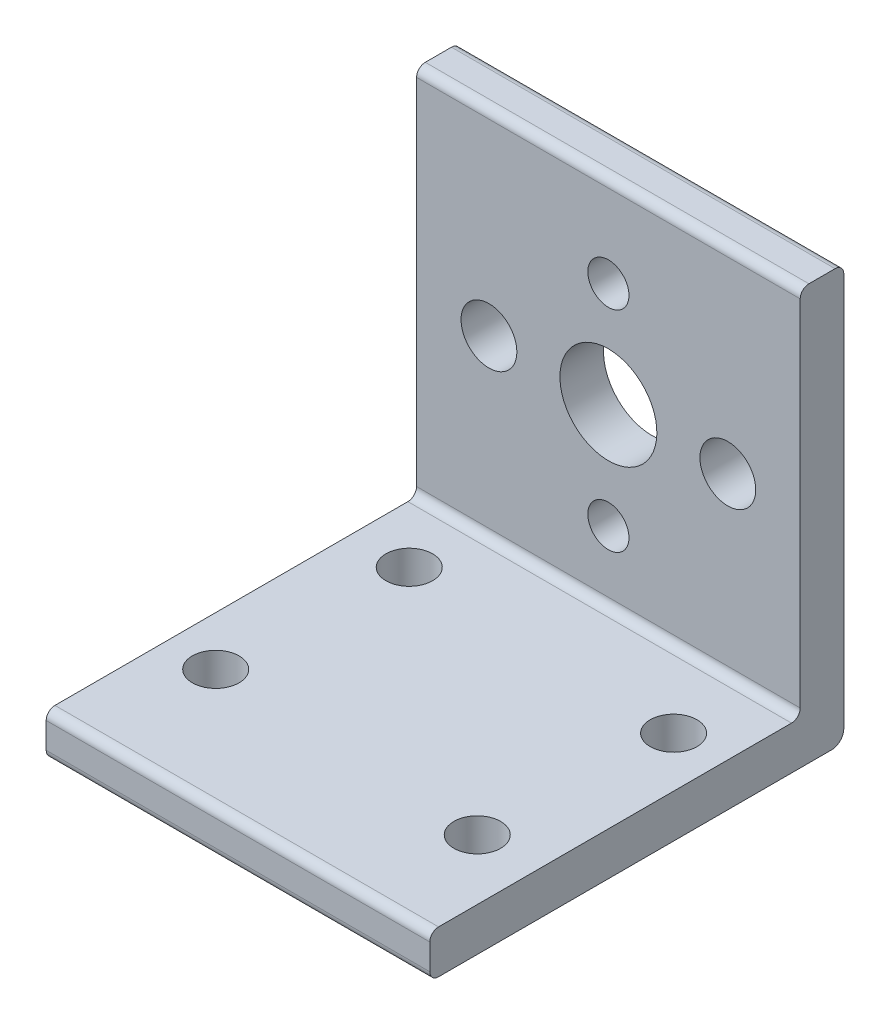
from build123d import *

# Parameters (mm, degrees)
BOSS_EXTRUDE1_DEPTH     = 27.94
SKETCH2_R               = 3.5306
SKETCH2_R_2             = 1.4986
SKETCH2_R_3             = 2.032
MOTOR_MOUNT_HOLES_DEPTH = 52.022202187
SKETCH3_R               = 1.7018
PLATE_MOUNT_HOLES_DEPTH = 52.022202187
FILLET1_R               = 0.635
FILLET2_R               = 0.889
FILLET3_R               = 0.635


with BuildPart() as part:
    # Sketch1 → Boss-Extrude1 (new body)
    with BuildSketch(Plane(origin=(0, 0, 0), x_dir=(0, 0, -1), z_dir=(1, 0, 0))):
        Polygon((0, 0), (0, -30.226), (-30.1498, -30.226), (-30.1498, -27.0764), (-3.175, -27.0764), (-3.175, 0), align=None)
    extrude(amount=BOSS_EXTRUDE1_DEPTH)

    # Sketch2 → Motor_Mount_holes (cut, through all)
    with BuildSketch(Plane.XY):
        with Locations((13.97, -14.3002)):
            Circle(SKETCH2_R)
        with Locations((13.97, -6.6548)):
            Circle(SKETCH2_R_2)
        with Locations((5.2705, -14.3002)):
            Circle(SKETCH2_R_3)
        with Locations((22.6695, -14.3002)):
            Circle(SKETCH2_R_3)
        with Locations((13.97, -21.9456)):
            Circle(SKETCH2_R_2)
    extrude(amount=MOTOR_MOUNT_HOLES_DEPTH, mode=Mode.SUBTRACT)

    # Sketch3 → Plate_Mount_Holes (cut, through all)
    with BuildSketch(Plane(origin=(0, -30.226, 0), x_dir=(1, 0, 0), z_dir=(0, 1, 0))):
        with Locations((4.191, -7.8994)):
            Circle(SKETCH3_R)
        with Locations((24.2824, -8.7376)):
            Circle(SKETCH3_R)
        with Locations((3.5814, -21.3868)):
            Circle(SKETCH3_R)
        with Locations((23.5458, -22.3012)):
            Circle(SKETCH3_R)
    extrude(amount=PLATE_MOUNT_HOLES_DEPTH, mode=Mode.SUBTRACT)

    # Fillet1
    fillet1_edges = [part.edges().sort_by_distance(p)[0] for p in [
        (13.97, -27.0764, 3.175),
    ]]
    fillet(fillet1_edges, radius=FILLET1_R)

    # Fillet2
    fillet2_edges = [part.edges().sort_by_distance(p)[0] for p in [
        (13.97, -30.226, 0),
    ]]
    fillet(fillet2_edges, radius=FILLET2_R)

    # Fillet3
    fillet3_edges = [part.edges().sort_by_distance(p)[0] for p in [
        (13.97, -30.226, 30.1498),
        (13.97, -27.0764, 30.1498),
        (13.97, 0, 0),
        (13.97, 0, 3.175),
    ]]
    fillet(fillet3_edges, radius=FILLET3_R)


solid = part.part
